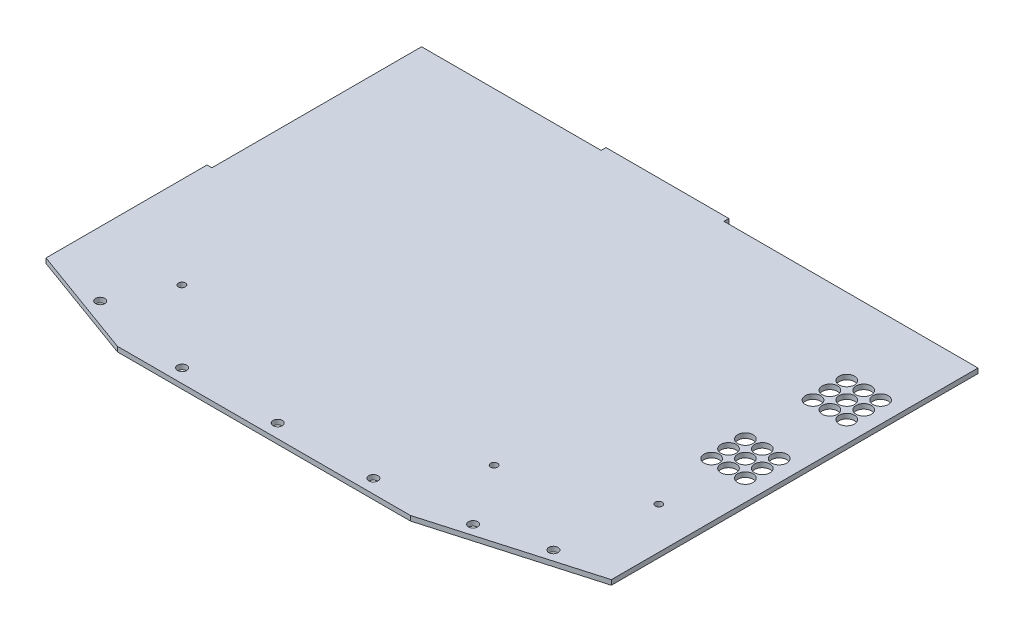
from build123d import *

# Parameters (mm, degrees)
SKETCH1_W               = 308.1112
SKETCH1_H               = 3.175
BOSS_EXTRUDE1_DEPTH     = 267.83
SKETCH3_W               = 267.83
SKETCH3_H               = 3.175
BOSS_EXTRUDE3_DEPTH     = 3.175
SKETCH4_W               = 50.87366
SKETCH4_H               = 3.175
BOSS_EXTRUDE4_DEPTH     = 267.83
CUT_EXTRUDE1_DEPTH      = 340.190761306
CUT_EXTRUDE3_DEPTH      = 340.190761306
SKETCH17_W              = 105.930619964
SKETCH17_H              = 3.175
BOSS_EXTRUDE5_DEPTH     = 3.175
CUT_EXTRUDE7_DEPTH      = 340.190761306
CUT_EXTRUDE7_DEPTH_BACK = 340.190761306
SKETCH25_R              = 3
CUT_EXTRUDE8_DEPTH      = 3.175
SKETCH27_R              = 5
CUT_EXTRUDE9_DEPTH      = 340.190761306
M4_CLEARANCE_HOLE1_D    = 4.5
SKETCH30_W              = 80
SKETCH30_H              = 3.175
BOSS_EXTRUDE6_DEPTH     = 3.175


with BuildPart() as part:
    # Sketch1 → Boss-Extrude1 (new body)
    with BuildSketch(Plane.XY):
        Rectangle(SKETCH1_W, SKETCH1_H)
    extrude(amount=BOSS_EXTRUDE1_DEPTH)

    # Sketch3 → Boss-Extrude3 (add)
    with BuildSketch(Plane(origin=(154.0556, 0, 0), x_dir=(0, 0, -1), z_dir=(1, 0, 0))):
        with Locations((-133.915, 0)):
            Rectangle(SKETCH3_W, SKETCH3_H)
    extrude(amount=BOSS_EXTRUDE3_DEPTH)

    # Sketch4 → Boss-Extrude4 (add)
    with BuildSketch(Plane.XY.offset(267.83)):
        with Locations((182.66743, 0)):
            Rectangle(SKETCH4_W, SKETCH4_H)
    extrude(amount=-BOSS_EXTRUDE4_DEPTH)

    # Sketch6 → Cut-Extrude1 (cut, through all)
    with BuildSketch(Plane(origin=(0, 1.5875, 0), x_dir=(1, 0, 0), z_dir=(0, 1, 0))):
        Polygon((208.10426, -238.620139294), (106.50426, -267.83), (208.10426, -267.83), align=None)
    extrude(amount=-CUT_EXTRUDE1_DEPTH, mode=Mode.SUBTRACT)

    # Sketch11 → Cut-Extrude3 (cut, through all)
    with BuildSketch(Plane.XZ.offset(1.5875)):
        Polygon((-154.0556, 242.43), (-84.2056, 267.83), (-154.0556, 267.83), align=None)
    extrude(amount=-CUT_EXTRUDE3_DEPTH, mode=Mode.SUBTRACT)

    # Sketch17 → Boss-Extrude5 (add)
    with BuildSketch(Plane.ZY.offset(154.0556)):
        with Locations((189.464690018, 0)):
            Rectangle(SKETCH17_W, SKETCH17_H)
    extrude(amount=BOSS_EXTRUDE5_DEPTH)

    # Sketch23 → Cut-Extrude7 (cut, two sides: drawn at the far end of the back side and taken through both)
    with BuildSketch(Plane(origin=(0, 1.5875, 0), x_dir=(1, 0, 0), z_dir=(0, 1, 0)).offset(-CUT_EXTRUDE7_DEPTH_BACK)):
        Polygon((678.256720653, -545.089025692), (-154.0556, -242.43), (-157.2306, -241.275454545), (-989.542920653, 61.383571147), (-1594.860972038, -1603.24107016), (72.938669269, -2209.713666999), align=None)
    extrude(amount=CUT_EXTRUDE7_DEPTH + CUT_EXTRUDE7_DEPTH_BACK, mode=Mode.SUBTRACT)

    # Sketch25 → Cut-Extrude8 (cut)
    with BuildSketch(Plane.XZ.offset(1.5875)):
        with Locations((-115.3206, 247.915394364)):
            Circle(SKETCH25_R)
        with Locations((-50.97574, 258.94)):
            Circle(SKETCH25_R)
        with Locations((11.25426, 258.94)):
            Circle(SKETCH25_R)
        with Locations((73.48426, 258.94)):
            Circle(SKETCH25_R)
        with Locations((172.54426, 240.761310541)):
            Circle(SKETCH25_R)
        with Locations((131.90426, 252.445254824)):
            Circle(SKETCH25_R)
    extrude(amount=-CUT_EXTRUDE8_DEPTH, mode=Mode.SUBTRACT)

    # Sketch27 → Cut-Extrude9 (cut, through all)
    with BuildSketch(Plane.XZ.offset(1.5875)):
        with Locations((172.48674, 137.774823778)):
            Circle(SKETCH27_R)
        with Locations((183.48674, 137.774823778)):
            Circle(SKETCH27_R)
        with Locations((194.48674, 137.774823778)):
            Circle(SKETCH27_R)
        with Locations((194.48674, 126.774823778)):
            Circle(SKETCH27_R)
        with Locations((194.48674, 115.774823778)):
            Circle(SKETCH27_R)
        with Locations((183.48674, 126.774823778)):
            Circle(SKETCH27_R)
        with Locations((183.48674, 115.774823778)):
            Circle(SKETCH27_R)
        with Locations((172.48674, 115.774823778)):
            Circle(SKETCH27_R)
        with Locations((172.48674, 126.774823778)):
            Circle(SKETCH27_R)
        with Locations((194.48674, 71.774823778)):
            Circle(SKETCH27_R)
        with Locations((194.48674, 60.774823778)):
            Circle(SKETCH27_R)
        with Locations((194.48674, 49.774823778)):
            Circle(SKETCH27_R)
        with Locations((183.48674, 71.774823778)):
            Circle(SKETCH27_R)
        with Locations((183.48674, 60.774823778)):
            Circle(SKETCH27_R)
        with Locations((183.48674, 49.774823778)):
            Circle(SKETCH27_R)
        with Locations((172.48674, 49.774823778)):
            Circle(SKETCH27_R)
        with Locations((172.48674, 60.774823778)):
            Circle(SKETCH27_R)
        with Locations((172.48674, 71.774823778)):
            Circle(SKETCH27_R)
    extrude(amount=-CUT_EXTRUDE9_DEPTH, mode=Mode.SUBTRACT)

    # M4 Clearance Hole1 (through all)
    with Locations(Plane.XZ.offset(1.5875)):
        with Locations((180.96500002, 180.586), (105.42905, 212.2849914), (-97.77095, 212.2849914)):
            Hole(M4_CLEARANCE_HOLE1_D / 2)

    # Sketch30 → Boss-Extrude6 (add)
    with BuildSketch(Plane(origin=(0, 0, 0), x_dir=(-1, 0, 0), z_dir=(0, 0, -1))):
        with Locations((-2.78399998, 0)):
            Rectangle(SKETCH30_W, SKETCH30_H)
    extrude(amount=BOSS_EXTRUDE6_DEPTH)


solid = part.part
